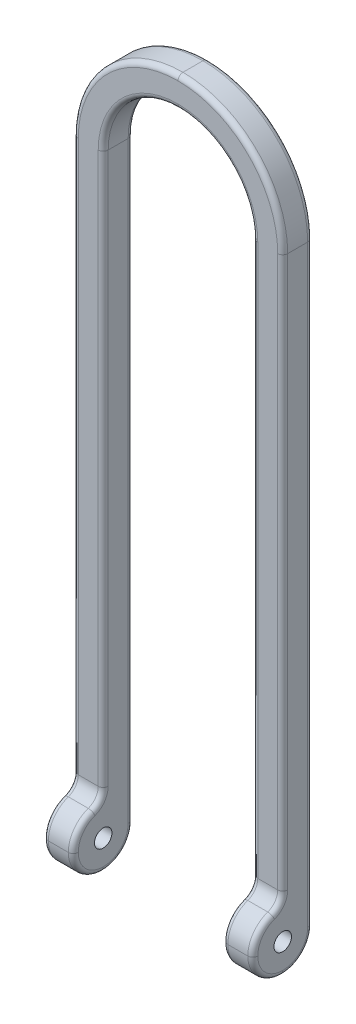
from build123d import *

# Parameters (mm, degrees)
BOSS_EXTRU_1_DEPTH           = 6
ESQUISSE2_W                  = 6
ESQUISSE2_H                  = 12
BOSS_EXTRU_2_DEPTH           = 6
BOSS_EXTRU_3_START           = -36
ESQUISSE2_2_W                = 6
ESQUISSE2_2_H                = 12
BOSS_EXTRU_3_DEPTH           = 6
CONG_1_R                     = 15
CONG_2_R                     = 21
ENL_V_MAT_EXTRU_1_DEPTH      = 153.394225612
ENL_V_MAT_EXTRU_1_DEPTH_BACK = 153.394225612
ESQUISSE3_R                  = 1.75
CONG_4_R                     = 6
CONG_5_R                     = 3
CONG_6_R                     = 1


with BuildPart() as part:
    # Esquisse1 → Boss.-Extru.1 (new body)
    with BuildSketch(Plane.XY):
        Polygon((15, 0), (15, 140), (-15, 140), (-15, 0), (-21, 0), (-21, 146), (21, 146), (21, 0), align=None)
    extrude(amount=BOSS_EXTRU_1_DEPTH)

    # Esquisse2 → Boss.-Extru.2 (add)
    with BuildSketch(Plane(origin=(21, 0, 0), x_dir=(0, 0, -1), z_dir=(1, 0, 0))):
        with Locations((-9, 6)):
            Rectangle(ESQUISSE2_W, ESQUISSE2_H)
    extrude(amount=-BOSS_EXTRU_2_DEPTH)

    # Esquisse2<2> → Boss.-Extru.3 (add)
    with BuildSketch(Plane(origin=(21, 0, 0), x_dir=(0, 0, -1), z_dir=(1, 0, 0)).offset(BOSS_EXTRU_3_START)):
        with Locations((-9, 6)):
            Rectangle(ESQUISSE2_2_W, ESQUISSE2_2_H)
    extrude(amount=-BOSS_EXTRU_3_DEPTH)

    # Congé1
    cong_1_edges = [part.edges().sort_by_distance(p)[0] for p in [
        (15, 140, 3),
        (-15, 140, 3),
    ]]
    fillet(cong_1_edges, radius=CONG_1_R - 0.0001)  # a hair under: the kernel refuses the full size

    # Congé2
    cong_2_edges = [part.edges().sort_by_distance(p)[0] for p in [
        (21, 146, 3),
        (-21, 146, 3),
    ]]
    fillet(cong_2_edges, radius=CONG_2_R - 0.0001)  # a hair under: the kernel refuses the full size

    # Esquisse3 → Enlèv. mat.-Extru.1 (cut, two sides: drawn at the far end of the back side and taken through both)
    with BuildSketch(Plane.ZY.offset(21).offset(-ENL_V_MAT_EXTRU_1_DEPTH_BACK)):
        with Locations((6, 6)):
            Circle(ESQUISSE3_R)
    extrude(amount=ENL_V_MAT_EXTRU_1_DEPTH + ENL_V_MAT_EXTRU_1_DEPTH_BACK, mode=Mode.SUBTRACT)

    # Congé4
    cong_4_edges = [part.edges().sort_by_distance(p)[0] for p in [
        (18, 0, 0),
        (-18, 0, 0),
        (18, 0, 12),
        (-18, 0, 12),
        (18, 12, 12),
        (-18, 12, 12),
    ]]
    fillet(cong_4_edges, radius=CONG_4_R - 0.0001)  # a hair under: the kernel refuses the full size

    # Congé5
    cong_5_edges = [part.edges().sort_by_distance(p)[0] for p in [
        (18, 12, 6),
        (-18, 12, 6),
    ]]
    fillet(cong_5_edges, radius=CONG_5_R)

    # Congé6
    cong_6_edges = [part.edges().sort_by_distance(p)[0] for p in [
        (21, 69.742705332, 6),
        (-15, 69.742705332, 6),
        (21, 9.464163125, 10.898984228),
        (-15, 9.464163125, 10.898984228),
        (21, 12.753250233, 6.550517061),
        (15, 12.753250233, 6.550517061),
        (-15, 12.753250233, 6.550517061),
        (-21, 12.753250233, 6.550517061),
        (15, 65.5, 0),
        (15, 69.742705332, 6),
        (10.606631007, 135.606631007, 0),
        (10.606631007, 135.606631007, 6),
        (-10.606631007, 135.606631007, 0),
        (-10.606631007, 135.606631007, 6),
        (-21, 65.5, 0),
        (-14.849271694, 139.849271694, 0),
        (14.849271694, 139.849271694, 0),
        (-21, 69.742705332, 6),
        (-14.849271694, 139.849271694, 6),
        (14.849271694, 139.849271694, 6),
        (21, 65.5, 0),
        (21, 1.757330024, 1.757330024),
        (21, 1.757330024, 10.242669976),
        (15, 1.757330024, 1.757330024),
        (15, 1.757330024, 10.242669976),
        (15, 9.464163125, 10.898984228),
        (-15, 65.5, 0),
        (-15, 1.757330024, 1.757330024),
        (-15, 1.757330024, 10.242669976),
        (-21, 1.757330024, 1.757330024),
        (-21, 1.757330024, 10.242669976),
        (-21, 9.464163125, 10.898984228),
    ]]
    fillet(cong_6_edges, radius=CONG_6_R)


solid = part.part
